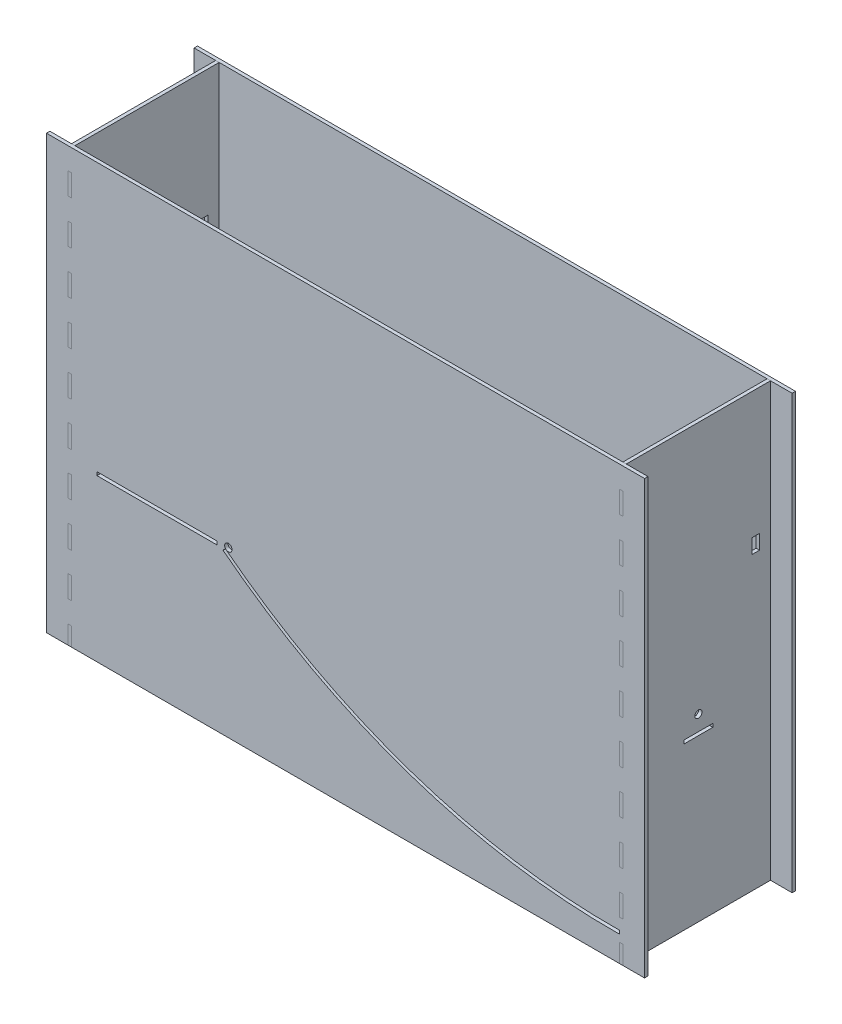
from build123d import *

# Parameters (mm, degrees)
SKETCH1_W                  = 488.5944
SKETCH1_H                  = 132.9944
SKETCH1_W_2                = 482.6
SKETCH1_H_2                = 127
BASE_EXTRUDE_DEPTH         = 2.9972
SKETCH1_3_W                = 488.5944
SKETCH1_3_H                = 132.9944
SKETCH1_3_W_2              = 482.6
SKETCH1_3_H_2              = 127
WALL_EXTRUDE_DEPTH         = 383.9972
RODRAMP_W                  = 105.8672
RODRAMP_H                  = 2.9972
RODRAMP_R                  = 3.2385
FRONTBACK_CUTS_1_DEPTH     = 475.154491666
SKETCH19_R                 = 3.175
SKETCH19_W                 = 25.4
SKETCH19_H                 = 2.9972
SKETCH19_W_2               = 6.477
SKETCH19_H_2               = 12.827
SIDE_CUTS_DEPTH            = 625.980171627
SKETCH23_W                 = 19.05
SKETCH23_H                 = 383.9972
BOSS_EXTRUDE1_DEPTH        = 2.9972
BOSS_EXTRUDE2_START        = -132.9944
SKETCH23_2_W               = 19.05
SKETCH23_2_H               = 383.9972
BOSS_EXTRUDE2_DEPTH        = 2.9972
SKETCH21_W                 = 12.827
SKETCH21_H                 = 6.477
SKETCH21_W_2               = 6.477
SKETCH21_H_2               = 12.827
SKETCH21_W_3               = 3.175
BOTTOM_SUPPORT_HOLES_DEPTH = 471.348248603
SPLIT1_START               = -244.2972
SPLIT1_OUTLINE_W           = 12.827
SPLIT1_OUTLINE_H           = 6.477
SPLIT1_OUTLINE_W_2         = 2.9972
SPLIT1_OUTLINE_H_2         = 25.4
SPLIT1_OUTLINE_R           = 3.175
SPLIT1_DEPTH               = 2.9972
SPLIT1_START_2             = 2.9972
SPLIT1_2_OUTLINE_W         = 2.9972
SPLIT1_2_OUTLINE_H         = 127
SPLIT1_2_DEPTH             = 381
SPLIT1_3_OUTLINE_W         = 2.9972
SPLIT1_3_OUTLINE_H         = 12.0904
SPLIT1_3_DEPTH             = 19.19986
SPLIT1_START_3             = 38.39972
SPLIT1_4_OUTLINE_W         = 2.9972
SPLIT1_4_OUTLINE_H         = 2.9972
SPLIT1_4_DEPTH             = 19.19986
SPLIT1_START_4             = 76.79944
SPLIT1_5_OUTLINE_W         = 2.9972
SPLIT1_5_OUTLINE_H         = 2.9972
SPLIT1_5_DEPTH             = 19.19986
SPLIT1_START_5             = 115.19916
SPLIT1_6_OUTLINE_W         = 2.9972
SPLIT1_6_OUTLINE_H         = 2.9972
SPLIT1_6_DEPTH             = 19.19986
SPLIT1_START_6             = 153.59888
SPLIT1_7_OUTLINE_W         = 2.9972
SPLIT1_7_OUTLINE_H         = 2.9972
SPLIT1_7_DEPTH             = 19.19986
SPLIT1_START_7             = 191.9986
SPLIT1_8_OUTLINE_W         = 2.9972
SPLIT1_8_OUTLINE_H         = 2.9972
SPLIT1_8_DEPTH             = 19.19986
SPLIT1_START_8             = 230.39832
SPLIT1_9_OUTLINE_W         = 2.9972
SPLIT1_9_OUTLINE_H         = 2.9972
SPLIT1_9_DEPTH             = 19.19986
SPLIT1_START_9             = 268.79804
SPLIT1_10_OUTLINE_W        = 2.9972
SPLIT1_10_OUTLINE_H        = 2.9972
SPLIT1_10_DEPTH            = 19.19986
SPLIT1_START_10            = 307.19776
SPLIT1_11_OUTLINE_W        = 2.9972
SPLIT1_11_OUTLINE_H        = 2.9972
SPLIT1_11_DEPTH            = 19.19986
SPLIT1_START_11            = 345.59748
SPLIT1_12_OUTLINE_W        = 2.9972
SPLIT1_12_OUTLINE_H        = 2.9972
SPLIT1_12_DEPTH            = 19.19986
SPLIT2_START               = 241.3
SPLIT2_OUTLINE_W           = 12.827
SPLIT2_OUTLINE_H           = 6.477
SPLIT2_OUTLINE_W_2         = 2.9972
SPLIT2_OUTLINE_H_2         = 25.4
SPLIT2_OUTLINE_R           = 3.175
SPLIT2_DEPTH               = 2.9972
SPLIT2_START_2             = 2.9972
SPLIT2_2_OUTLINE_W         = 2.9972
SPLIT2_2_OUTLINE_H         = 127
SPLIT2_2_DEPTH             = 381
SPLIT2_3_OUTLINE_W         = 2.9972
SPLIT2_3_OUTLINE_H         = 12.0904
SPLIT2_3_DEPTH             = 19.19986
SPLIT2_START_3             = 38.39972
SPLIT2_4_OUTLINE_W         = 2.9972
SPLIT2_4_OUTLINE_H         = 2.9972
SPLIT2_4_DEPTH             = 19.19986
SPLIT2_START_4             = 76.79944
SPLIT2_5_OUTLINE_W         = 2.9972
SPLIT2_5_OUTLINE_H         = 2.9972
SPLIT2_5_DEPTH             = 19.19986
SPLIT2_START_5             = 115.19916
SPLIT2_6_OUTLINE_W         = 2.9972
SPLIT2_6_OUTLINE_H         = 2.9972
SPLIT2_6_DEPTH             = 19.19986
SPLIT2_START_6             = 153.59888
SPLIT2_7_OUTLINE_W         = 2.9972
SPLIT2_7_OUTLINE_H         = 2.9972
SPLIT2_7_DEPTH             = 19.19986
SPLIT2_START_7             = 191.9986
SPLIT2_8_OUTLINE_W         = 2.9972
SPLIT2_8_OUTLINE_H         = 2.9972
SPLIT2_8_DEPTH             = 19.19986
SPLIT2_START_8             = 230.39832
SPLIT2_9_OUTLINE_W         = 2.9972
SPLIT2_9_OUTLINE_H         = 2.9972
SPLIT2_9_DEPTH             = 19.19986
SPLIT2_START_9             = 268.79804
SPLIT2_10_OUTLINE_W        = 2.9972
SPLIT2_10_OUTLINE_H        = 2.9972
SPLIT2_10_DEPTH            = 19.19986
SPLIT2_START_10            = 307.19776
SPLIT2_11_OUTLINE_W        = 2.9972
SPLIT2_11_OUTLINE_H        = 2.9972
SPLIT2_11_DEPTH            = 19.19986
SPLIT2_START_11            = 345.59748
SPLIT2_12_OUTLINE_W        = 2.9972
SPLIT2_12_OUTLINE_H        = 2.9972
SPLIT2_12_DEPTH            = 19.19986
SKETCH22_W                 = 526.6944
SKETCH22_H                 = 2.9972
CUT_EXTRUDE5_DEPTH         = 485.24488411


# Read off the part's stored shape, not the designer's step: Split1, Split2
with BuildPart() as part:
    # Sketch1 → Base Extrude (new body)
    # profile 1 of 2: a face of its own
    with BuildSketch(Plane(origin=(0, 0, 0), x_dir=(1, 0, 0), z_dir=(0, 1, 0))):
        Rectangle(SKETCH1_W, SKETCH1_H)
        Rectangle(SKETCH1_W_2, SKETCH1_H_2, mode=Mode.SUBTRACT)
    # profile 2 of 2: a face of its own
    with BuildSketch(Plane(origin=(0, 0, 0), x_dir=(1, 0, 0), z_dir=(0, 1, 0))):
        Rectangle(SKETCH1_W_2, SKETCH1_H_2)
    extrude(amount=BASE_EXTRUDE_DEPTH)

    # Sketch1<3> → Wall Extrude (add)
    with BuildSketch(Plane(origin=(0, 0, 0), x_dir=(1, 0, 0), z_dir=(0, 1, 0))):
        Rectangle(SKETCH1_3_W, SKETCH1_3_H)
        Rectangle(SKETCH1_3_W_2, SKETCH1_3_H_2, mode=Mode.SUBTRACT)
    extrude(amount=WALL_EXTRUDE_DEPTH)

    # RodRamp → FrontBack Cuts 1 (cut, through all)
    with BuildSketch(Plane.XY.offset(66.4972)):
        with BuildLine():
            ThreePointArc((-107.817810804, 143.595486444), (56.694406096, 54.822516177), (241.3, 25.4))
            Line((241.3, 25.4), (241.3, 28.397361105))
            ThreePointArc((241.3, 28.397361105), (57.670212476, 57.656462399), (-105.97255023, 145.957312275))
            Line((-105.97255023, 145.957312275), (-107.817810804, 143.595486444))
        make_face()
        with Locations((-165.9636, 146.550417861)):
            Rectangle(RODRAMP_W, RODRAMP_H)
        with Locations((-103.1875, 148.049017861)):
            Circle(RODRAMP_R)
    extrude(amount=-FRONTBACK_CUTS_1_DEPTH, mode=Mode.SUBTRACT)

    # Sketch19 → Side Cuts (cut, through all)
    with BuildSketch(Plane.ZY.offset(244.2972)):
        with Locations((0, 161.511017861)):
            Circle(SKETCH19_R)
        with Locations((0, 146.550417861)):
            Rectangle(SKETCH19_W, SKETCH19_H)
        with Locations((-50.5587, 266.02310893)):
            Rectangle(SKETCH19_W_2, SKETCH19_H_2)
        with Locations((50.5587, 266.02310893)):
            Rectangle(SKETCH19_W_2, SKETCH19_H_2)
    extrude(amount=-SIDE_CUTS_DEPTH, mode=Mode.SUBTRACT)

    # Sketch23 → Boss-Extrude1 (add)
    with BuildSketch(Plane.XY.offset(66.4972)):
        with Locations((-253.8222, 191.9986)):
            Rectangle(SKETCH23_W, SKETCH23_H)
        with Locations((253.8222, 191.9986)):
            Rectangle(SKETCH23_W, SKETCH23_H)
    extrude(amount=-BOSS_EXTRUDE1_DEPTH)

    # Sketch23<2> → Boss-Extrude2 (add)
    with BuildSketch(Plane.XY.offset(66.4972).offset(BOSS_EXTRUDE2_START)):
        with Locations((-253.8222, 191.9986)):
            Rectangle(SKETCH23_2_W, SKETCH23_2_H)
        with Locations((253.8222, 191.9986)):
            Rectangle(SKETCH23_2_W, SKETCH23_2_H)
    extrude(amount=BOSS_EXTRUDE2_DEPTH)

    # Sketch21 → Bottom Support Holes (cut, through all)
    with BuildSketch(Plane.XZ):
        with Locations((0, 50.5587)):
            Rectangle(SKETCH21_W, SKETCH21_H)
        with Locations((-228.3587, 0)):
            Rectangle(SKETCH21_W_2, SKETCH21_H_2)
        with Locations((0, -50.5587)):
            Rectangle(SKETCH21_W, SKETCH21_H)
        with Locations((230.0097, 0)):
            Rectangle(SKETCH21_W_3, SKETCH21_H_2)
    extrude(amount=-BOTTOM_SUPPORT_HOLES_DEPTH, mode=Mode.SUBTRACT)

    # Split1 2 outline → Split1 2 (cut)
    with BuildSketch(Plane(origin=(0, 0, 0), x_dir=(1, 0, 0), z_dir=(0, 1, 0)).offset(SPLIT1_START_2)):
        with Locations((-242.7986, 0)):
            Rectangle(SPLIT1_2_OUTLINE_W, SPLIT1_2_OUTLINE_H)
    extrude(amount=SPLIT1_2_DEPTH, mode=Mode.SUBTRACT)

    # Split1 3 outline → Split1 3 (cut)
    with BuildSketch(Plane(origin=(0, 0, 0), x_dir=(1, 0, 0), z_dir=(0, 1, 0))):
        with Locations((-242.7986, 60.452)):
            Rectangle(SPLIT1_3_OUTLINE_W, SPLIT1_3_OUTLINE_H)
        with Locations((-242.7986, 36.2712)):
            Rectangle(SPLIT1_3_OUTLINE_W, SPLIT1_3_OUTLINE_H)
        with Locations((-242.7986, 12.0904)):
            Rectangle(SPLIT1_3_OUTLINE_W, SPLIT1_3_OUTLINE_H)
        with Locations((-242.7986, -12.0904)):
            Rectangle(SPLIT1_3_OUTLINE_W, SPLIT1_3_OUTLINE_H)
        with Locations((-242.7986, -36.2712)):
            Rectangle(SPLIT1_3_OUTLINE_W, SPLIT1_3_OUTLINE_H)
        with Locations((-242.7986, -60.452)):
            Rectangle(SPLIT1_3_OUTLINE_W, SPLIT1_3_OUTLINE_H)
    extrude(amount=SPLIT1_3_DEPTH, mode=Mode.SUBTRACT)

    # Split1 4 outline → Split1 4 (cut)
    with BuildSketch(Plane(origin=(0, 0, 0), x_dir=(1, 0, 0), z_dir=(0, 1, 0)).offset(SPLIT1_START_3)):
        with Locations((-242.7986, 64.9986)):
            Rectangle(SPLIT1_4_OUTLINE_W, SPLIT1_4_OUTLINE_H)
        with Locations((-242.7986, -64.9986)):
            Rectangle(SPLIT1_4_OUTLINE_W, SPLIT1_4_OUTLINE_H)
    extrude(amount=SPLIT1_4_DEPTH, mode=Mode.SUBTRACT)

    # Split1 5 outline → Split1 5 (cut)
    with BuildSketch(Plane(origin=(0, 0, 0), x_dir=(1, 0, 0), z_dir=(0, 1, 0)).offset(SPLIT1_START_4)):
        with Locations((-242.7986, 64.9986)):
            Rectangle(SPLIT1_5_OUTLINE_W, SPLIT1_5_OUTLINE_H)
        with Locations((-242.7986, -64.9986)):
            Rectangle(SPLIT1_5_OUTLINE_W, SPLIT1_5_OUTLINE_H)
    extrude(amount=SPLIT1_5_DEPTH, mode=Mode.SUBTRACT)

    # Split1 6 outline → Split1 6 (cut)
    with BuildSketch(Plane(origin=(0, 0, 0), x_dir=(1, 0, 0), z_dir=(0, 1, 0)).offset(SPLIT1_START_5)):
        with Locations((-242.7986, 64.9986)):
            Rectangle(SPLIT1_6_OUTLINE_W, SPLIT1_6_OUTLINE_H)
        with Locations((-242.7986, -64.9986)):
            Rectangle(SPLIT1_6_OUTLINE_W, SPLIT1_6_OUTLINE_H)
    extrude(amount=SPLIT1_6_DEPTH, mode=Mode.SUBTRACT)

    # Split1 7 outline → Split1 7 (cut)
    with BuildSketch(Plane(origin=(0, 0, 0), x_dir=(1, 0, 0), z_dir=(0, 1, 0)).offset(SPLIT1_START_6)):
        with Locations((-242.7986, 64.9986)):
            Rectangle(SPLIT1_7_OUTLINE_W, SPLIT1_7_OUTLINE_H)
        with Locations((-242.7986, -64.9986)):
            Rectangle(SPLIT1_7_OUTLINE_W, SPLIT1_7_OUTLINE_H)
    extrude(amount=SPLIT1_7_DEPTH, mode=Mode.SUBTRACT)

    # Split1 8 outline → Split1 8 (cut)
    with BuildSketch(Plane(origin=(0, 0, 0), x_dir=(1, 0, 0), z_dir=(0, 1, 0)).offset(SPLIT1_START_7)):
        with Locations((-242.7986, 64.9986)):
            Rectangle(SPLIT1_8_OUTLINE_W, SPLIT1_8_OUTLINE_H)
        with Locations((-242.7986, -64.9986)):
            Rectangle(SPLIT1_8_OUTLINE_W, SPLIT1_8_OUTLINE_H)
    extrude(amount=SPLIT1_8_DEPTH, mode=Mode.SUBTRACT)

    # Split1 9 outline → Split1 9 (cut)
    with BuildSketch(Plane(origin=(0, 0, 0), x_dir=(1, 0, 0), z_dir=(0, 1, 0)).offset(SPLIT1_START_8)):
        with Locations((-242.7986, 64.9986)):
            Rectangle(SPLIT1_9_OUTLINE_W, SPLIT1_9_OUTLINE_H)
        with Locations((-242.7986, -64.9986)):
            Rectangle(SPLIT1_9_OUTLINE_W, SPLIT1_9_OUTLINE_H)
    extrude(amount=SPLIT1_9_DEPTH, mode=Mode.SUBTRACT)

    # Split1 10 outline → Split1 10 (cut)
    with BuildSketch(Plane(origin=(0, 0, 0), x_dir=(1, 0, 0), z_dir=(0, 1, 0)).offset(SPLIT1_START_9)):
        with Locations((-242.7986, 64.9986)):
            Rectangle(SPLIT1_10_OUTLINE_W, SPLIT1_10_OUTLINE_H)
        with Locations((-242.7986, -64.9986)):
            Rectangle(SPLIT1_10_OUTLINE_W, SPLIT1_10_OUTLINE_H)
    extrude(amount=SPLIT1_10_DEPTH, mode=Mode.SUBTRACT)

    # Split1 11 outline → Split1 11 (cut)
    with BuildSketch(Plane(origin=(0, 0, 0), x_dir=(1, 0, 0), z_dir=(0, 1, 0)).offset(SPLIT1_START_10)):
        with Locations((-242.7986, 64.9986)):
            Rectangle(SPLIT1_11_OUTLINE_W, SPLIT1_11_OUTLINE_H)
        with Locations((-242.7986, -64.9986)):
            Rectangle(SPLIT1_11_OUTLINE_W, SPLIT1_11_OUTLINE_H)
    extrude(amount=SPLIT1_11_DEPTH, mode=Mode.SUBTRACT)

    # Split1 12 outline → Split1 12 (cut)
    with BuildSketch(Plane(origin=(0, 0, 0), x_dir=(1, 0, 0), z_dir=(0, 1, 0)).offset(SPLIT1_START_11)):
        with Locations((-242.7986, 64.9986)):
            Rectangle(SPLIT1_12_OUTLINE_W, SPLIT1_12_OUTLINE_H)
        with Locations((-242.7986, -64.9986)):
            Rectangle(SPLIT1_12_OUTLINE_W, SPLIT1_12_OUTLINE_H)
    extrude(amount=SPLIT1_12_DEPTH, mode=Mode.SUBTRACT)

    # Split2 2 outline → Split2 2 (cut)
    with BuildSketch(Plane(origin=(0, 0, 0), x_dir=(1, 0, 0), z_dir=(0, 1, 0)).offset(SPLIT2_START_2)):
        with Locations((242.7986, 0)):
            Rectangle(SPLIT2_2_OUTLINE_W, SPLIT2_2_OUTLINE_H)
    extrude(amount=SPLIT2_2_DEPTH, mode=Mode.SUBTRACT)

    # Split2 3 outline → Split2 3 (cut)
    with BuildSketch(Plane(origin=(0, 0, 0), x_dir=(1, 0, 0), z_dir=(0, 1, 0))):
        with Locations((242.7986, 60.452)):
            Rectangle(SPLIT2_3_OUTLINE_W, SPLIT2_3_OUTLINE_H)
        with Locations((242.7986, 36.2712)):
            Rectangle(SPLIT2_3_OUTLINE_W, SPLIT2_3_OUTLINE_H)
        with Locations((242.7986, 12.0904)):
            Rectangle(SPLIT2_3_OUTLINE_W, SPLIT2_3_OUTLINE_H)
        with Locations((242.7986, -12.0904)):
            Rectangle(SPLIT2_3_OUTLINE_W, SPLIT2_3_OUTLINE_H)
        with Locations((242.7986, -36.2712)):
            Rectangle(SPLIT2_3_OUTLINE_W, SPLIT2_3_OUTLINE_H)
        with Locations((242.7986, -60.452)):
            Rectangle(SPLIT2_3_OUTLINE_W, SPLIT2_3_OUTLINE_H)
    extrude(amount=SPLIT2_3_DEPTH, mode=Mode.SUBTRACT)

    # Split2 4 outline → Split2 4 (cut)
    with BuildSketch(Plane(origin=(0, 0, 0), x_dir=(1, 0, 0), z_dir=(0, 1, 0)).offset(SPLIT2_START_3)):
        with Locations((242.7986, 64.9986)):
            Rectangle(SPLIT2_4_OUTLINE_W, SPLIT2_4_OUTLINE_H)
        with Locations((242.7986, -64.9986)):
            Rectangle(SPLIT2_4_OUTLINE_W, SPLIT2_4_OUTLINE_H)
    extrude(amount=SPLIT2_4_DEPTH, mode=Mode.SUBTRACT)

    # Split2 5 outline → Split2 5 (cut)
    with BuildSketch(Plane(origin=(0, 0, 0), x_dir=(1, 0, 0), z_dir=(0, 1, 0)).offset(SPLIT2_START_4)):
        with Locations((242.7986, 64.9986)):
            Rectangle(SPLIT2_5_OUTLINE_W, SPLIT2_5_OUTLINE_H)
        with Locations((242.7986, -64.9986)):
            Rectangle(SPLIT2_5_OUTLINE_W, SPLIT2_5_OUTLINE_H)
    extrude(amount=SPLIT2_5_DEPTH, mode=Mode.SUBTRACT)

    # Split2 6 outline → Split2 6 (cut)
    with BuildSketch(Plane(origin=(0, 0, 0), x_dir=(1, 0, 0), z_dir=(0, 1, 0)).offset(SPLIT2_START_5)):
        with Locations((242.7986, 64.9986)):
            Rectangle(SPLIT2_6_OUTLINE_W, SPLIT2_6_OUTLINE_H)
        with Locations((242.7986, -64.9986)):
            Rectangle(SPLIT2_6_OUTLINE_W, SPLIT2_6_OUTLINE_H)
    extrude(amount=SPLIT2_6_DEPTH, mode=Mode.SUBTRACT)

    # Split2 7 outline → Split2 7 (cut)
    with BuildSketch(Plane(origin=(0, 0, 0), x_dir=(1, 0, 0), z_dir=(0, 1, 0)).offset(SPLIT2_START_6)):
        with Locations((242.7986, 64.9986)):
            Rectangle(SPLIT2_7_OUTLINE_W, SPLIT2_7_OUTLINE_H)
        with Locations((242.7986, -64.9986)):
            Rectangle(SPLIT2_7_OUTLINE_W, SPLIT2_7_OUTLINE_H)
    extrude(amount=SPLIT2_7_DEPTH, mode=Mode.SUBTRACT)

    # Split2 8 outline → Split2 8 (cut)
    with BuildSketch(Plane(origin=(0, 0, 0), x_dir=(1, 0, 0), z_dir=(0, 1, 0)).offset(SPLIT2_START_7)):
        with Locations((242.7986, 64.9986)):
            Rectangle(SPLIT2_8_OUTLINE_W, SPLIT2_8_OUTLINE_H)
        with Locations((242.7986, -64.9986)):
            Rectangle(SPLIT2_8_OUTLINE_W, SPLIT2_8_OUTLINE_H)
    extrude(amount=SPLIT2_8_DEPTH, mode=Mode.SUBTRACT)

    # Split2 9 outline → Split2 9 (cut)
    with BuildSketch(Plane(origin=(0, 0, 0), x_dir=(1, 0, 0), z_dir=(0, 1, 0)).offset(SPLIT2_START_8)):
        with Locations((242.7986, 64.9986)):
            Rectangle(SPLIT2_9_OUTLINE_W, SPLIT2_9_OUTLINE_H)
        with Locations((242.7986, -64.9986)):
            Rectangle(SPLIT2_9_OUTLINE_W, SPLIT2_9_OUTLINE_H)
    extrude(amount=SPLIT2_9_DEPTH, mode=Mode.SUBTRACT)

    # Split2 10 outline → Split2 10 (cut)
    with BuildSketch(Plane(origin=(0, 0, 0), x_dir=(1, 0, 0), z_dir=(0, 1, 0)).offset(SPLIT2_START_9)):
        with Locations((242.7986, 64.9986)):
            Rectangle(SPLIT2_10_OUTLINE_W, SPLIT2_10_OUTLINE_H)
        with Locations((242.7986, -64.9986)):
            Rectangle(SPLIT2_10_OUTLINE_W, SPLIT2_10_OUTLINE_H)
    extrude(amount=SPLIT2_10_DEPTH, mode=Mode.SUBTRACT)

    # Split2 11 outline → Split2 11 (cut)
    with BuildSketch(Plane(origin=(0, 0, 0), x_dir=(1, 0, 0), z_dir=(0, 1, 0)).offset(SPLIT2_START_10)):
        with Locations((242.7986, 64.9986)):
            Rectangle(SPLIT2_11_OUTLINE_W, SPLIT2_11_OUTLINE_H)
        with Locations((242.7986, -64.9986)):
            Rectangle(SPLIT2_11_OUTLINE_W, SPLIT2_11_OUTLINE_H)
    extrude(amount=SPLIT2_11_DEPTH, mode=Mode.SUBTRACT)

    # Split2 12 outline → Split2 12 (cut)
    with BuildSketch(Plane(origin=(0, 0, 0), x_dir=(1, 0, 0), z_dir=(0, 1, 0)).offset(SPLIT2_START_11)):
        with Locations((242.7986, 64.9986)):
            Rectangle(SPLIT2_12_OUTLINE_W, SPLIT2_12_OUTLINE_H)
        with Locations((242.7986, -64.9986)):
            Rectangle(SPLIT2_12_OUTLINE_W, SPLIT2_12_OUTLINE_H)
    extrude(amount=SPLIT2_12_DEPTH, mode=Mode.SUBTRACT)


with BuildPart() as body_2:
    # Split1 outline → Split1 (new body)
    with BuildSketch(Plane.YZ.offset(SPLIT1_START)):
        Polygon((38.39972, 63.5), (19.19986, 63.5), (19.19986, 66.4972), (0, 66.4972), (0, 54.4068), (2.9972, 54.4068), (2.9972, 42.3164), (0, 42.3164), (0, 30.226), (2.9972, 30.226), (2.9972, 18.1356), (0, 18.1356), (0, 6.0452), (2.9972, 6.0452), (2.9972, -6.0452), (0, -6.0452), (0, -18.1356), (2.9972, -18.1356), (2.9972, -30.226), (0, -30.226), (0, -42.3164), (2.9972, -42.3164), (2.9972, -54.4068), (0, -54.4068), (0, -66.4972), (19.19986, -66.4972), (19.19986, -63.5), (38.39972, -63.5), (38.39972, -66.4972), (57.59958, -66.4972), (57.59958, -63.5), (76.79944, -63.5), (76.79944, -66.4972), (95.9993, -66.4972), (95.9993, -63.5), (115.19916, -63.5), (115.19916, -66.4972), (134.39902, -66.4972), (134.39902, -63.5), (153.59888, -63.5), (153.59888, -66.4972), (172.79874, -66.4972), (172.79874, -63.5), (191.9986, -63.5), (191.9986, -66.4972), (211.19846, -66.4972), (211.19846, -63.5), (230.39832, -63.5), (230.39832, -66.4972), (249.59818, -66.4972), (249.59818, -63.5), (268.79804, -63.5), (268.79804, -66.4972), (287.9979, -66.4972), (287.9979, -63.5), (307.19776, -63.5), (307.19776, -66.4972), (326.39762, -66.4972), (326.39762, -63.5), (345.59748, -63.5), (345.59748, -66.4972), (364.79734, -66.4972), (364.79734, -63.5), (383.9972, -63.5), (383.9972, 63.5), (364.79734, 63.5), (364.79734, 66.4972), (345.59748, 66.4972), (345.59748, 63.5), (326.39762, 63.5), (326.39762, 66.4972), (307.19776, 66.4972), (307.19776, 63.5), (287.9979, 63.5), (287.9979, 66.4972), (268.79804, 66.4972), (268.79804, 63.5), (249.59818, 63.5), (249.59818, 66.4972), (230.39832, 66.4972), (230.39832, 63.5), (211.19846, 63.5), (211.19846, 66.4972), (191.9986, 66.4972), (191.9986, 63.5), (172.79874, 63.5), (172.79874, 66.4972), (153.59888, 66.4972), (153.59888, 63.5), (134.39902, 63.5), (134.39902, 66.4972), (115.19916, 66.4972), (115.19916, 63.5), (95.9993, 63.5), (95.9993, 66.4972), (76.79944, 66.4972), (76.79944, 63.5), (57.59958, 63.5), (57.59958, 66.4972), (38.39972, 66.4972), align=None)
        with Locations((266.02310893, -50.5587)):
            Rectangle(SPLIT1_OUTLINE_W, SPLIT1_OUTLINE_H, mode=Mode.SUBTRACT)
        with Locations((146.550417861, 0)):
            Rectangle(SPLIT1_OUTLINE_W_2, SPLIT1_OUTLINE_H_2, mode=Mode.SUBTRACT)
        with Locations((161.511017861, 0)):
            Circle(SPLIT1_OUTLINE_R, mode=Mode.SUBTRACT)
        with Locations((266.02310893, 50.5587)):
            Rectangle(SPLIT1_OUTLINE_W, SPLIT1_OUTLINE_H, mode=Mode.SUBTRACT)
    extrude(amount=SPLIT1_DEPTH)


with BuildPart() as body_3:
    # Split2 outline → Split2 (new body)
    with BuildSketch(Plane.YZ.offset(SPLIT2_START)):
        Polygon((383.9972, 63.5), (364.79734, 63.5), (364.79734, 66.4972), (345.59748, 66.4972), (345.59748, 63.5), (326.39762, 63.5), (326.39762, 66.4972), (307.19776, 66.4972), (307.19776, 63.5), (287.9979, 63.5), (287.9979, 66.4972), (268.79804, 66.4972), (268.79804, 63.5), (249.59818, 63.5), (249.59818, 66.4972), (230.39832, 66.4972), (230.39832, 63.5), (211.19846, 63.5), (211.19846, 66.4972), (191.9986, 66.4972), (191.9986, 63.5), (172.79874, 63.5), (172.79874, 66.4972), (153.59888, 66.4972), (153.59888, 63.5), (134.39902, 63.5), (134.39902, 66.4972), (115.19916, 66.4972), (115.19916, 63.5), (95.9993, 63.5), (95.9993, 66.4972), (76.79944, 66.4972), (76.79944, 63.5), (57.59958, 63.5), (57.59958, 66.4972), (38.39972, 66.4972), (38.39972, 63.5), (19.19986, 63.5), (19.19986, 66.4972), (0, 66.4972), (0, 54.4068), (2.9972, 54.4068), (2.9972, 42.3164), (0, 42.3164), (0, 30.226), (2.9972, 30.226), (2.9972, 18.1356), (0, 18.1356), (0, 6.0452), (2.9972, 6.0452), (2.9972, -6.0452), (0, -6.0452), (0, -18.1356), (2.9972, -18.1356), (2.9972, -30.226), (0, -30.226), (0, -42.3164), (2.9972, -42.3164), (2.9972, -54.4068), (0, -54.4068), (0, -66.4972), (19.19986, -66.4972), (19.19986, -63.5), (38.39972, -63.5), (38.39972, -66.4972), (57.59958, -66.4972), (57.59958, -63.5), (76.79944, -63.5), (76.79944, -66.4972), (95.9993, -66.4972), (95.9993, -63.5), (115.19916, -63.5), (115.19916, -66.4972), (134.39902, -66.4972), (134.39902, -63.5), (153.59888, -63.5), (153.59888, -66.4972), (172.79874, -66.4972), (172.79874, -63.5), (191.9986, -63.5), (191.9986, -66.4972), (211.19846, -66.4972), (211.19846, -63.5), (230.39832, -63.5), (230.39832, -66.4972), (249.59818, -66.4972), (249.59818, -63.5), (268.79804, -63.5), (268.79804, -66.4972), (287.9979, -66.4972), (287.9979, -63.5), (307.19776, -63.5), (307.19776, -66.4972), (326.39762, -66.4972), (326.39762, -63.5), (345.59748, -63.5), (345.59748, -66.4972), (364.79734, -66.4972), (364.79734, -63.5), (383.9972, -63.5), align=None)
        with Locations((266.02310893, -50.5587)):
            Rectangle(SPLIT2_OUTLINE_W, SPLIT2_OUTLINE_H, mode=Mode.SUBTRACT)
        with Locations((146.550417861, 0)):
            Rectangle(SPLIT2_OUTLINE_W_2, SPLIT2_OUTLINE_H_2, mode=Mode.SUBTRACT)
        with Locations((161.511017861, 0)):
            Circle(SPLIT2_OUTLINE_R, mode=Mode.SUBTRACT)
        with Locations((266.02310893, 50.5587)):
            Rectangle(SPLIT2_OUTLINE_W, SPLIT2_OUTLINE_H, mode=Mode.SUBTRACT)
    extrude(amount=SPLIT2_DEPTH)


with BuildPart() as cut_extrude5_tool:
    # Sketch22 → Cut-Extrude5 (new, through all)
    with BuildSketch(Plane.XY.offset(66.4972)):
        with Locations((0, 1.4986)):
            Rectangle(SKETCH22_W, SKETCH22_H)
    extrude(amount=-CUT_EXTRUDE5_DEPTH)


with BuildPart() as part_1:
    add(part.part)

    # Cut-Extrude5: cut by cut_extrude5_tool
    add(cut_extrude5_tool.part, mode=Mode.SUBTRACT)


with BuildPart() as body_2_1:
    add(body_2.part)

    # Cut-Extrude5: cut by cut_extrude5_tool
    add(cut_extrude5_tool.part, mode=Mode.SUBTRACT)


with BuildPart() as body_3_1:
    add(body_3.part)

    # Cut-Extrude5: cut by cut_extrude5_tool
    add(cut_extrude5_tool.part, mode=Mode.SUBTRACT)


solid = Compound([part_1.part, body_2_1.part, body_3_1.part])
